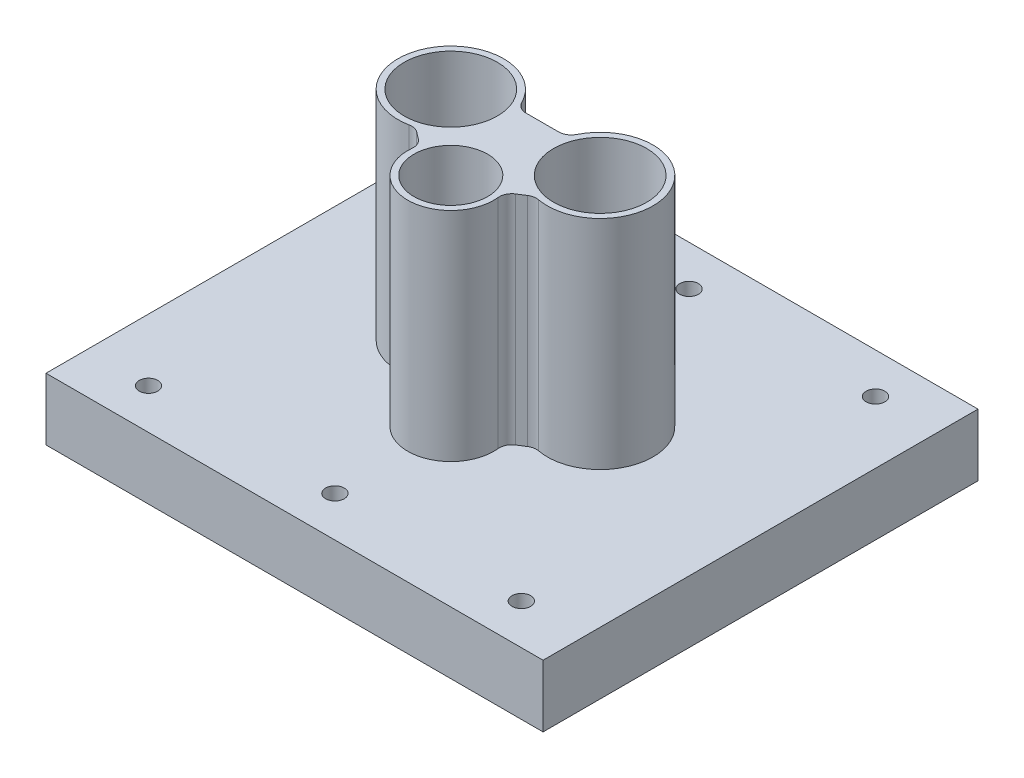
from build123d import *

# Parameters (mm, degrees)
BOSS_EXTRUDE1_OUTLINE_R   = 5.925
BOSS_EXTRUDE1_OUTLINE_R_2 = 7.5
BOSS_EXTRUDE1_DEPTH       = 45
SKETCH7_W                 = 80
SKETCH7_H                 = 70
BOSS_EXTRUDE2_DEPTH       = 10
SKETCH9_R                 = 1.5
SKETCH9_R_2               = 7.5
SKETCH9_R_3               = 5.925
CUT_EXTRUDE1_DEPTH        = 70.545797618
CUT_EXTRUDE2_DEPTH        = 2.5


# Read off the part's stored shape, not the designer's step: Boss-Extrude1
with BuildPart() as part:
    # Boss-Extrude1 outline → Boss-Extrude1 (new body)
    with BuildSketch(Plane(origin=(0, 0, 0), x_dir=(1, 0, 0), z_dir=(0, 1, 0))):
        with BuildLine():
            Line((2.640241809, 14.738319), (-2.640241809, 14.738319))
            ThreePointArc((-2.640241809, 14.738319), (-3.689731143, 15.03579965), (-4.427017708, 15.839746863))
            ThreePointArc((-4.427017708, 15.839746863), (-19.653719539, 15.760972037), (-10.385543741, 3.679599122))
            ThreePointArc((-10.385543741, 3.679599122), (-9.543059286, 3.663879971), (-8.781822294, 3.302569315))
            Line((-8.781822294, 3.302569315), (-7.664695593, 2.443767924))
            ThreePointArc((-7.664695593, 2.443767924), (-7.049045485, 1.654548176), (-6.892913986, 0.665854179))
            ThreePointArc((-6.892913986, 0.665854179), (0.034441884, -6.92491435), (6.88594973, 0.734384995))
            ThreePointArc((6.88594973, 0.734384995), (7.072047194, 1.812821739), (7.797876599, 2.63186371))
            Line((7.797876599, 2.63186371), (8.985297239, 3.390509952))
            ThreePointArc((8.985297239, 3.390509952), (9.683500506, 3.668968165), (10.435182401, 3.670020805))
            ThreePointArc((10.435182401, 3.670020805), (19.642563369, 15.783654111), (4.427017708, 15.839746863))
            ThreePointArc((4.427017708, 15.839746863), (3.689731143, 15.03579965), (2.640241809, 14.738319))
        make_face()
        Circle(BOSS_EXTRUDE1_OUTLINE_R, mode=Mode.SUBTRACT)
        with Locations((-12.02081528, 12.02081528)):
            Circle(BOSS_EXTRUDE1_OUTLINE_R_2, mode=Mode.SUBTRACT)
        with Locations((12.02081528, 12.02081528)):
            Circle(BOSS_EXTRUDE1_OUTLINE_R_2, mode=Mode.SUBTRACT)
    extrude(amount=BOSS_EXTRUDE1_DEPTH)

    # Sketch7 → Boss-Extrude2 (add)
    # profile 1 of 2: a face of its own
    with BuildSketch(Plane.XZ):
        with Locations((0, -9.851064271)):
            Rectangle(SKETCH7_W, SKETCH7_H)
        with BuildLine():
            ThreePointArc((6.88594973, -0.734384995), (7.072047194, -1.812821739), (7.797876599, -2.63186371))
            Line((7.797876599, -2.63186371), (8.985297239, -3.390509952))
            ThreePointArc((8.985297239, -3.390509952), (9.683500506, -3.668968165), (10.435182401, -3.670020805))
            ThreePointArc((10.435182401, -3.670020805), (19.642563369, -15.783654111), (4.427017708, -15.839746863))
            ThreePointArc((4.427017708, -15.839746863), (3.689731143, -15.03579965), (2.640241809, -14.738319))
            Line((2.640241809, -14.738319), (-2.640241809, -14.738319))
            ThreePointArc((-2.640241809, -14.738319), (-3.689731143, -15.03579965), (-4.427017708, -15.839746863))
            ThreePointArc((-4.427017708, -15.839746863), (-19.653719539, -15.760972037), (-10.385543741, -3.679599122))
            ThreePointArc((-10.385543741, -3.679599122), (-9.543059286, -3.663879971), (-8.781822294, -3.302569315))
            Line((-8.781822294, -3.302569315), (-7.664695593, -2.443767924))
            ThreePointArc((-7.664695593, -2.443767924), (-7.049045485, -1.654548176), (-6.892913986, -0.665854179))
            ThreePointArc((-6.892913986, -0.665854179), (0.034441884, 6.92491435), (6.88594973, -0.734384995))
        make_face(mode=Mode.SUBTRACT)
    # profile 2 of 2: a face of its own
    with BuildSketch(Plane.XZ):
        with Locations((0, -9.851064271)):
            Rectangle(SKETCH7_W, SKETCH7_H)
        with BuildLine():
            ThreePointArc((6.88594973, -0.734384995), (7.072047194, -1.812821739), (7.797876599, -2.63186371))
            Line((7.797876599, -2.63186371), (8.985297239, -3.390509952))
            ThreePointArc((8.985297239, -3.390509952), (9.683500506, -3.668968165), (10.435182401, -3.670020805))
            ThreePointArc((10.435182401, -3.670020805), (19.642563369, -15.783654111), (4.427017708, -15.839746863))
            ThreePointArc((4.427017708, -15.839746863), (3.689731143, -15.03579965), (2.640241809, -14.738319))
            Line((2.640241809, -14.738319), (-2.640241809, -14.738319))
            ThreePointArc((-2.640241809, -14.738319), (-3.689731143, -15.03579965), (-4.427017708, -15.839746863))
            ThreePointArc((-4.427017708, -15.839746863), (-19.653719539, -15.760972037), (-10.385543741, -3.679599122))
            ThreePointArc((-10.385543741, -3.679599122), (-9.543059286, -3.663879971), (-8.781822294, -3.302569315))
            Line((-8.781822294, -3.302569315), (-7.664695593, -2.443767924))
            ThreePointArc((-7.664695593, -2.443767924), (-7.049045485, -1.654548176), (-6.892913986, -0.665854179))
            ThreePointArc((-6.892913986, -0.665854179), (0.034441884, 6.92491435), (6.88594973, -0.734384995))
        make_face(mode=Mode.SUBTRACT)
    extrude(amount=-BOSS_EXTRUDE2_DEPTH)

    # Sketch9 → Cut-Extrude1 (cut, through all)
    with BuildSketch(Plane(origin=(0, 10, 0), x_dir=(-1, 0, 0), z_dir=(0, -1, 0))):
        with Locations(Location((-30, 38.351064271, 0), (0, 0, 90))):
            Circle(SKETCH9_R)
        with Locations(Location((-30, -18.648935729, 0), (0, 0, 90))):
            Circle(SKETCH9_R)
        with Locations(Location((0, -18.648935729, 0), (0, 0, 90))):
            Circle(SKETCH9_R)
        with Locations(Location((30, -18.648935729, 0), (0, 0, 90))):
            Circle(SKETCH9_R)
        with Locations(Location((30, 38.351064271, 0), (0, 0, 90))):
            Circle(SKETCH9_R)
        with Locations(Location((0, 38.351064271, 0), (0, 0, 90))):
            Circle(SKETCH9_R)
        with Locations(Location((-12.02081528, 12.02081528, 0), (0, 0, 90))):
            Circle(SKETCH9_R_2)
        with Locations(Location((12.02081528, 12.02081528, 0), (0, 0, 90))):
            Circle(SKETCH9_R_2)
        with Locations(Location((0, 0, 0), (0, 0, 90))):
            Circle(SKETCH9_R_3)
    extrude(amount=CUT_EXTRUDE1_DEPTH, mode=Mode.SUBTRACT)

    # Sketch10 → Cut-Extrude2 (cut)
    with BuildSketch(Plane(origin=(0, 0, 0), x_dir=(-1, 0, 0), z_dir=(0, 1, 0))):
        with BuildLine():
            Line((-11.434840744, 7.500002811), (-25.410017566, 7.500002811))
            ThreePointArc((-25.410017566, 7.500002811), (-30.80127054, 5.410534914), (-33.376311069, 0.233600397))
            ThreePointArc((-33.376311069, 0.233600397), (-4.816e-06, -33.377128543), (33.376311137, 0.233590765))
            ThreePointArc((33.376311137, 0.233590765), (30.801273238, 5.410526556), (25.410021357, 7.499997189))
            Line((25.410021357, 7.499997189), (11.434844431, 7.499997189))
            ThreePointArc((11.434844431, 7.499997189), (3.362e-06, 13.675), (-11.434840744, 7.500002811))
        make_face()
    extrude(amount=CUT_EXTRUDE2_DEPTH, mode=Mode.SUBTRACT)


solid = part.part
